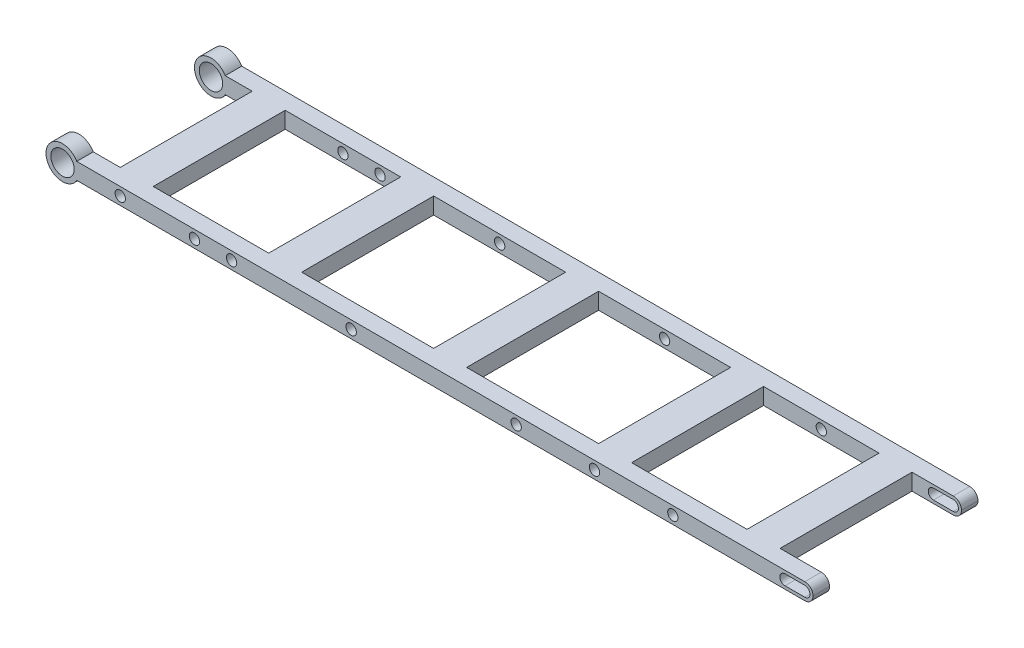
from build123d import *

# Parameters (mm, degrees)
SKETCH1_W              = 50.8
SKETCH1_H              = 50.8
SKETCH1_W_2            = 44.45
BOSS_EXTRUDE1_DEPTH    = 6.35
FILLET2_R              = 3.175
SKETCH2_R              = 6.35
BOSS_EXTRUDE3_DEPTH    = 6.35
BOSS_EXTRUDE4_START    = -6.35
SKETCH4_R              = 6.35
BOSS_EXTRUDE4_DEPTH    = 6.35
CUT_EXTRUDE1_REACH     = 164.453
SKETCH2_4_R            = 4.49961
SKETCH2_4_R_2          = 1.9939
BOSS_EXTRUDE5_DEPTH    = 127
CUT_EXTRUDE2_START     = -31.75
CUT_EXTRUDE2_OUTLINE_R = 2
CUT_EXTRUDE2_DEPTH     = 63.5


# Read off the part's stored shape, not the designer's step: Cut-Extrude2
with BuildPart() as part:
    # Sketch1 → Boss-Extrude1 (new body)
    with BuildSketch(Plane(origin=(0, 0, 0), x_dir=(1, 0, 0), z_dir=(0, 1, 0))):
        Polygon((-146.05, 25.4), (-127, 25.4), (-127, -25.4), (-146.05, -25.4), (-146.05, -31.75), (146.05, -31.75), (146.05, -25.4), (127, -25.4), (127, 25.4), (146.05, 25.4), (146.05, 31.75), (-146.05, 31.75), align=None)
        with Locations((-31.75, 0)):
            Rectangle(SKETCH1_W, SKETCH1_H, mode=Mode.SUBTRACT)
        with Locations((-92.075, 0)):
            Rectangle(SKETCH1_W_2, SKETCH1_H, mode=Mode.SUBTRACT)
        with Locations((31.75, 0)):
            Rectangle(SKETCH1_W, SKETCH1_H, mode=Mode.SUBTRACT)
        with Locations((92.075, 0)):
            Rectangle(SKETCH1_W_2, SKETCH1_H, mode=Mode.SUBTRACT)
    extrude(amount=-BOSS_EXTRUDE1_DEPTH)

    # Fillet2
    fillet2_edges = [part.edges().sort_by_distance(p)[0] for p in [
        (-146.05, -6.35, 28.575),
        (-146.05, 0, 28.575),
        (-146.05, -6.35, -28.575),
        (-146.05, 0, -28.575),
        (146.05, -6.35, -28.575),
        (146.05, 0, -28.575),
        (146.05, -6.35, 28.575),
        (146.05, 0, 28.575),
    ]]
    fillet(fillet2_edges, radius=FILLET2_R - 0.0001)  # a hair under: the kernel refuses the full size

    # Sketch2 → Boss-Extrude3 (add)
    with BuildSketch(Plane.XY.offset(31.75)):
        with Locations((-142.875, -3.175)):
            Circle(SKETCH2_R)
    extrude(amount=-BOSS_EXTRUDE3_DEPTH)

    # Sketch4 → Boss-Extrude4 (add)
    with BuildSketch(Plane(origin=(0, 0, -31.75), x_dir=(-1, 0, 0), z_dir=(0, 0, -1)).offset(BOSS_EXTRUDE4_START)):
        with Locations((142.875, -3.175)):
            Circle(SKETCH4_R)
    extrude(amount=BOSS_EXTRUDE4_DEPTH)

    # Cut-Extrude1: up to this face of the body (flat: up to its plane)
    cut_extrude1_end = Plane(part.part.faces().sort_by_distance((-5.43222234, -3.175, -31.75))[0])
    # Sketch2<4> → Cut-Extrude1 (cut, up to the picked face)
    with BuildSketch(Plane.XY.offset(31.75), mode=Mode.PRIVATE) as cut_extrude1_sk1:
        with Locations((-142.875, -3.175)):
            Circle(SKETCH2_4_R)
    cut_extrude1_tool1 = split(extrude(cut_extrude1_sk1.sketch, amount=-CUT_EXTRUDE1_REACH, mode=Mode.PRIVATE), bisect_by=cut_extrude1_end, keep=Keep.BOTH, mode=Mode.PRIVATE)
    # Sketch2<4> → Cut-Extrude1 (cut, up to the picked face)
    with BuildSketch(Plane.XY.offset(31.75), mode=Mode.PRIVATE) as cut_extrude1_sk2:
        with Locations((-92.075, -3.175)):
            Circle(SKETCH2_4_R_2)
    cut_extrude1_tool2 = split(extrude(cut_extrude1_sk2.sketch, amount=-CUT_EXTRUDE1_REACH, mode=Mode.PRIVATE), bisect_by=cut_extrude1_end, keep=Keep.BOTH, mode=Mode.PRIVATE)
    # Sketch2<4> → Cut-Extrude1 (cut, up to the picked face)
    with BuildSketch(Plane.XY.offset(31.75), mode=Mode.PRIVATE) as cut_extrude1_sk3:
        with Locations((-31.75, -3.175)):
            Circle(SKETCH2_4_R_2)
    cut_extrude1_tool3 = split(extrude(cut_extrude1_sk3.sketch, amount=-CUT_EXTRUDE1_REACH, mode=Mode.PRIVATE), bisect_by=cut_extrude1_end, keep=Keep.BOTH, mode=Mode.PRIVATE)
    # Sketch2<4> → Cut-Extrude1 (cut, up to the picked face)
    with BuildSketch(Plane.XY.offset(31.75), mode=Mode.PRIVATE) as cut_extrude1_sk4:
        with Locations((31.75, -3.175)):
            Circle(SKETCH2_4_R_2)
    cut_extrude1_tool4 = split(extrude(cut_extrude1_sk4.sketch, amount=-CUT_EXTRUDE1_REACH, mode=Mode.PRIVATE), bisect_by=cut_extrude1_end, keep=Keep.BOTH, mode=Mode.PRIVATE)
    # Sketch2<4> → Cut-Extrude1 (cut, up to the picked face)
    with BuildSketch(Plane.XY.offset(31.75), mode=Mode.PRIVATE) as cut_extrude1_sk5:
        with Locations((92.075, -3.175)):
            Circle(SKETCH2_4_R_2)
    cut_extrude1_tool5 = split(extrude(cut_extrude1_sk5.sketch, amount=-CUT_EXTRUDE1_REACH, mode=Mode.PRIVATE), bisect_by=cut_extrude1_end, keep=Keep.BOTH, mode=Mode.PRIVATE)
    # Sketch2<4> → Cut-Extrude1 (cut, up to the picked face)
    with BuildSketch(Plane.XY.offset(31.75), mode=Mode.PRIVATE) as cut_extrude1_sk6:
        with Locations((-120.65, -3.175)):
            Circle(SKETCH2_4_R_2)
    cut_extrude1_tool6 = split(extrude(cut_extrude1_sk6.sketch, amount=-CUT_EXTRUDE1_REACH, mode=Mode.PRIVATE), bisect_by=cut_extrude1_end, keep=Keep.BOTH, mode=Mode.PRIVATE)
    # Sketch2<4> → Cut-Extrude1 (cut, up to the picked face)
    with BuildSketch(Plane.XY.offset(31.75), mode=Mode.PRIVATE) as cut_extrude1_sk7:
        with Locations((61.9125, -3.175)):
            Circle(SKETCH2_4_R_2)
    cut_extrude1_tool7 = split(extrude(cut_extrude1_sk7.sketch, amount=-CUT_EXTRUDE1_REACH, mode=Mode.PRIVATE), bisect_by=cut_extrude1_end, keep=Keep.BOTH, mode=Mode.PRIVATE)
    # Sketch2<4> → Cut-Extrude1 (cut, up to the picked face)
    with BuildSketch(Plane.XY.offset(31.75), mode=Mode.PRIVATE) as cut_extrude1_sk8:
        with BuildLine():
            Line((135.255, -1.1811), (142.875, -1.1811))
            ThreePointArc((142.875, -1.1811), (144.8689, -3.175), (142.875, -5.1689))
            Line((142.875, -5.1689), (135.255, -5.1689))
            ThreePointArc((135.255, -5.1689), (133.2611, -3.175), (135.255, -1.1811))
        make_face()
    cut_extrude1_tool8 = split(extrude(cut_extrude1_sk8.sketch, amount=-CUT_EXTRUDE1_REACH, mode=Mode.PRIVATE), bisect_by=cut_extrude1_end, keep=Keep.BOTH, mode=Mode.PRIVATE)
    add(cut_extrude1_tool1.solids().sort_by(Axis((-142.875, -3.175, 31.75), (0, 0, -1)))[0], mode=Mode.SUBTRACT)
    add(cut_extrude1_tool2.solids().sort_by(Axis((-92.075, -3.175, 31.75), (0, 0, -1)))[0], mode=Mode.SUBTRACT)
    add(cut_extrude1_tool3.solids().sort_by(Axis((-31.75, -3.175, 31.75), (0, 0, -1)))[0], mode=Mode.SUBTRACT)
    add(cut_extrude1_tool4.solids().sort_by(Axis((31.75, -3.175, 31.75), (0, 0, -1)))[0], mode=Mode.SUBTRACT)
    add(cut_extrude1_tool5.solids().sort_by(Axis((92.075, -3.175, 31.75), (0, 0, -1)))[0], mode=Mode.SUBTRACT)
    add(cut_extrude1_tool6.solids().sort_by(Axis((-120.65, -3.175, 31.75), (0, 0, -1)))[0], mode=Mode.SUBTRACT)
    add(cut_extrude1_tool7.solids().sort_by(Axis((61.9125, -3.175, 31.75), (0, 0, -1)))[0], mode=Mode.SUBTRACT)
    add(cut_extrude1_tool8.solids().sort_by(Axis((139.065, -3.175, 31.75), (0, 0, -1)))[0], mode=Mode.SUBTRACT)

    # Sketch5 → Boss-Extrude5 (add)
    with BuildSketch(Plane(origin=(127, 0, 0), x_dir=(0, 0, -1), z_dir=(1, 0, 0))):
        Polygon((25.4, -6.35), (31.75, -6.35), (28.575, -9.525), align=None)
        Polygon((-31.75, -6.35), (-25.4, -6.35), (-28.575, -9.525), align=None)
    extrude(amount=-BOSS_EXTRUDE5_DEPTH)

    # Cut-Extrude2 outline → Cut-Extrude2 (cut)
    with BuildSketch(Plane.XY.offset(CUT_EXTRUDE2_START)):
        with Locations((-77.7875, -3.175)):
            Circle(CUT_EXTRUDE2_OUTLINE_R)
    extrude(amount=CUT_EXTRUDE2_DEPTH, mode=Mode.SUBTRACT)


solid = part.part
